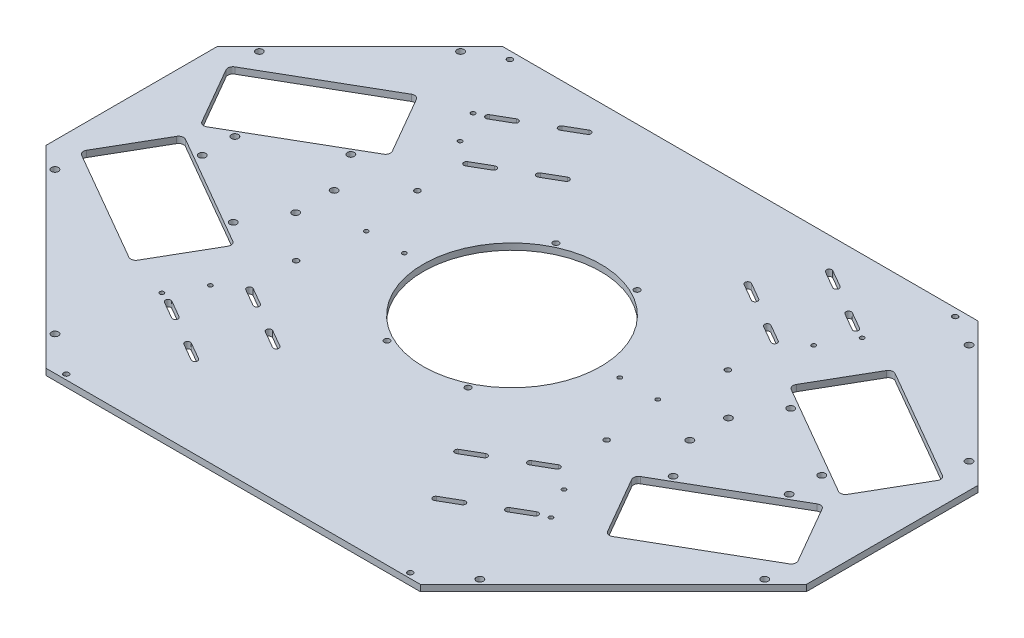
from build123d import *

# Parameters (mm, degrees)
EXTRUDE_1_DEPTH        = 5
CUT_EXTRUDE_1_REACH    = 374.055
SKETCH_3_R             = 70
HOLE_WIZARD_M4_1_D     = 4.3
CUT_EXTRUDE_2_REACH    = 374.055
FILLET_1_R             = 4
HOLE_WIZARD_M4_3_DEPTH = 5
HOLE_WIZARD_M5_2_D     = 5.5
HOLE_WIZARD_M5_3_D     = 5.5
HOLE_WIZARD_M4_2_D     = 4.5
HOLE_WIZARD_M4_1_2_D   = 3.3
HOLE_WIZARD_M4_2_2_D   = 3.3
FILLET_1_OF_MIRROR_1_R = 4
MIRROR_2_OUTLINE_R     = 1.65
MIRROR_2_OUTLINE_R_2   = 2.75
MIRROR_2_DEPTH         = 5
HOLE_WIZARD_M5_1_D     = 4.2


# Read off the part's stored shape, not the designer's step: M4 间隙槽口3, 镜向2
with BuildPart() as part:
    # 草图1 → 凸台-拉伸1 (new body)
    with BuildSketch(Plane(origin=(0, 0, 0), x_dir=(1, 0, 0), z_dir=(0, 1, 0))):
        Polygon((-300, 67.695526217), (-300, -67.695526217), (-147.695526217, -220), (147.695526217, -220), (300, -67.695526217), (300, 67.695526217), (187.695526217, 180), (-187.695526217, 180), align=None)
    extrude(amount=EXTRUDE_1_DEPTH)

    # 草图3 → 切除-拉伸1 (cut, up to next)
    with BuildSketch(Plane(origin=(0, 5, 0), x_dir=(1, 0, 0), z_dir=(0, 1, 0)), mode=Mode.PRIVATE) as cut_extrude_1_sk1:
        with Locations(Location((0, 0, 0), (0, 0, 270))):
            Circle(SKETCH_3_R)
    cut_extrude_1_tool1 = extrude(cut_extrude_1_sk1.sketch, amount=-CUT_EXTRUDE_1_REACH, mode=Mode.PRIVATE) & part.part
    add(cut_extrude_1_tool1.solids().sort_by_distance((0, 5, 0))[0], mode=Mode.SUBTRACT)

    # Hole Wizard M4 _1 (through all)
    with Locations(Plane(origin=(0, 5, 0), x_dir=(1, 0, 0), z_dir=(0, 1, 0))):
        with Locations((122.5, 47.85), (-122.5, -47.85), (-122.5, 47.85), (122.5, -47.85)):
            Hole(HOLE_WIZARD_M4_1_D / 2)

    # 草图6 → 切除-拉伸2 (cut, up to next)
    with BuildSketch(Plane(origin=(0, 5, 0), x_dir=(1, 0, 0), z_dir=(0, 1, 0)), mode=Mode.PRIVATE) as cut_extrude_2_sk1:
        Polygon((157.368602792, -61.469237886), (252.631397208, -6.469237886), (282.631397208, -58.430762114), (187.368602792, -113.430762114), align=None)
    cut_extrude_2_tool1 = extrude(cut_extrude_2_sk1.sketch, amount=-CUT_EXTRUDE_2_REACH, mode=Mode.PRIVATE) & part.part
    cut_extrude_2 = cut_extrude_2_tool1.solids().sort_by_distance((220, 5, 59.95))[0]
    add(cut_extrude_2, mode=Mode.SUBTRACT)

    # 圆角1
    fillet_1_edges = [part.edges().sort_by_distance(p)[0] for p in [
        (187.368602792, 2.5, 113.430762114),
        (157.368602792, 2.5, 61.469237886),
        (252.631397208, 2.5, 6.469237886),
        (282.631397208, 2.5, 58.430762114),
    ]]
    fillet(fillet_1_edges, radius=FILLET_1_R)

    # M4 间隙槽口3 outline → M4 间隙槽口3 (cut)
    with BuildSketch(Plane(origin=(0, 0, 0), x_dir=(1, 0, 0), z_dir=(0, 1, 0))):
        with BuildLine():
            Line((108.978007779, -95.354268716), (122.574606619, -87.504268716))
            ThreePointArc((122.574606619, -87.504268716), (123.361561237, -84.567314098), (120.424606619, -83.78035948))
            Line((120.424606619, -83.78035948), (106.828007779, -91.63035948))
            ThreePointArc((106.828007779, -91.63035948), (106.041053161, -94.567314098), (108.978007779, -95.354268716))
        make_face()
        with BuildLine():
            ThreePointArc((86.20153966, -108.504268716), (86.988494278, -105.567314098), (84.05153966, -104.78035948))
            Line((84.05153966, -104.78035948), (70.45494082, -112.63035948))
            ThreePointArc((70.45494082, -112.63035948), (69.667986202, -115.567314098), (72.60494082, -116.354268716))
            Line((72.60494082, -116.354268716), (86.20153966, -108.504268716))
        make_face()
        with BuildLine():
            Line((132.478007779, -136.057462694), (146.074606619, -128.207462694))
            ThreePointArc((146.074606619, -128.207462694), (146.861561237, -125.270508076), (143.924606619, -124.483553458))
            Line((143.924606619, -124.483553458), (130.328007779, -132.333553458))
            ThreePointArc((130.328007779, -132.333553458), (129.541053161, -135.270508076), (132.478007779, -136.057462694))
        make_face()
        with BuildLine():
            ThreePointArc((109.70153966, -149.207462694), (110.488494278, -146.270508076), (107.55153966, -145.483553458))
            Line((107.55153966, -145.483553458), (93.95494082, -153.333553458))
            ThreePointArc((93.95494082, -153.333553458), (93.167986202, -156.270508076), (96.10494082, -157.057462694))
            Line((96.10494082, -157.057462694), (109.70153966, -149.207462694))
        make_face()
    hole_wizard_m4_3 = extrude(amount=HOLE_WIZARD_M4_3_DEPTH, mode=Mode.SUBTRACT)

    # M5 间隙孔2 (through all)
    with Locations(Plane(origin=(0, 5, 0), x_dir=(1, 0, 0), z_dir=(0, 1, 0))):
        with Locations((-200.624458405, 160), (-280, 80.624458405), (-167.624458405, -193), (-280, -80.624458405), (280, 80.624458405), (200.624458405, 160), (280, -80.624458405), (167.624458405, -193)):
            Hole(HOLE_WIZARD_M5_2_D / 2)

    # M5 间隙孔3 (through all)
    with Locations(Plane(origin=(0, 0, 0), x_dir=(-1, 0, 0), z_dir=(0, -1, 0))):
        with Locations((155.528595468, 15.201901859), (231.552297521, 12.878816395), (173.528595468, 46.378816395)):
            hole_wizard_m5_3 = Hole(HOLE_WIZARD_M5_3_D / 2)

    # Hole Wizard M4 _2 (through all)
    with Locations(Plane(origin=(0, 0, 0), x_dir=(-1, 0, 0), z_dir=(0, -1, 0))):
        with Locations((-32, -66.689982551), (32, -66.689982551)):
            hole_wizard_m4_2 = Hole(HOLE_WIZARD_M4_2_D / 2)

    # Hole Wizard M4 _1 2 (through all)
    with Locations(Plane(origin=(0, 5, 0), x_dir=(1, 0, 0), z_dir=(0, 1, 0))):
        with Locations((153.498739063, -122.76643729), (139.498739063, -98.517725984)):
            hole_wizard_m4_1_2 = Hole(HOLE_WIZARD_M4_1_2_D / 2)

    # Hole Wizard M4 _2 2 (through all)
    with Locations(Plane(origin=(0, 5, 0), x_dir=(1, 0, 0), z_dir=(0, 1, 0))):
        with Locations((85, 0), (115, 0)):
            Hole(HOLE_WIZARD_M4_2_2_D / 2)

    # 镜向1: 切除-拉伸2, M4 间隙槽口3, M5 间隙孔3, Hole Wizard M4 _2, Hole Wizard M4 _1 2 across plane
    add(cut_extrude_2.mirror(Plane.XY), mode=Mode.SUBTRACT)
    add(hole_wizard_m4_3.mirror(Plane.XY), mode=Mode.SUBTRACT)
    add(hole_wizard_m5_3.mirror(Plane.XY), mode=Mode.SUBTRACT)
    add(hole_wizard_m4_2.mirror(Plane.XY), mode=Mode.SUBTRACT)
    add(hole_wizard_m4_1_2.mirror(Plane.XY), mode=Mode.SUBTRACT)

    # 圆角1 of 镜向1
    fillet_1_of_mirror_1_edges = [part.edges().sort_by_distance(p)[0] for p in [
        (187.368602792, 2.5, -113.430762114),
        (157.368602792, 2.5, -61.469237886),
        (252.631397208, 2.5, -6.469237886),
        (282.631397208, 2.5, -58.430762114),
    ]]
    fillet(fillet_1_of_mirror_1_edges, radius=FILLET_1_OF_MIRROR_1_R)

    # 镜向2 outline → 镜向2 (cut)
    with BuildSketch(Plane(origin=(0, 0, 0), x_dir=(1, 0, 0), z_dir=(0, 1, 0))):
        with BuildLine():
            Line((-185.368602792, -109.966660498), (-159.368602792, -64.933339502))
            ThreePointArc((-159.368602792, -64.933339502), (-158.969001102, -61.898063321), (-160.832704407, -59.469237886))
            Line((-160.832704407, -59.469237886), (-249.167295593, -8.469237886))
            ThreePointArc((-249.167295593, -8.469237886), (-252.202571774, -8.069636196), (-254.631397208, -9.933339502))
            Line((-254.631397208, -9.933339502), (-280.631397208, -54.966660498))
            ThreePointArc((-280.631397208, -54.966660498), (-281.030998898, -58.001936679), (-279.167295593, -60.430762114))
            Line((-279.167295593, -60.430762114), (-190.832704407, -111.430762114))
            ThreePointArc((-190.832704407, -111.430762114), (-187.797428226, -111.830363804), (-185.368602792, -109.966660498))
        make_face()
        with Locations((-115, 0)):
            Circle(MIRROR_2_OUTLINE_R)
        with Locations((-85, 0)):
            Circle(MIRROR_2_OUTLINE_R)
        with BuildLine():
            ThreePointArc((-160.832704407, 59.469237886), (-158.969001102, 61.898063321), (-159.368602792, 64.933339502))
            Line((-159.368602792, 64.933339502), (-185.368602792, 109.966660498))
            ThreePointArc((-185.368602792, 109.966660498), (-187.797428226, 111.830363804), (-190.832704407, 111.430762114))
            Line((-190.832704407, 111.430762114), (-279.167295593, 60.430762114))
            ThreePointArc((-279.167295593, 60.430762114), (-281.030998898, 58.001936679), (-280.631397208, 54.966660498))
            Line((-280.631397208, 54.966660498), (-254.631397208, 9.933339502))
            ThreePointArc((-254.631397208, 9.933339502), (-252.202571774, 8.069636196), (-249.167295593, 8.469237886))
            Line((-249.167295593, 8.469237886), (-160.832704407, 59.469237886))
        make_face()
        with BuildLine():
            Line((-108.978007779, 95.354268716), (-122.574606619, 87.504268716))
            ThreePointArc((-122.574606619, 87.504268716), (-123.361561237, 84.567314098), (-120.424606619, 83.78035948))
            Line((-120.424606619, 83.78035948), (-106.828007779, 91.63035948))
            ThreePointArc((-106.828007779, 91.63035948), (-106.041053161, 94.567314098), (-108.978007779, 95.354268716))
        make_face()
        with BuildLine():
            ThreePointArc((-86.20153966, 108.504268716), (-86.988494278, 105.567314098), (-84.05153966, 104.78035948))
            Line((-84.05153966, 104.78035948), (-70.45494082, 112.63035948))
            ThreePointArc((-70.45494082, 112.63035948), (-69.667986202, 115.567314098), (-72.60494082, 116.354268716))
            Line((-72.60494082, 116.354268716), (-86.20153966, 108.504268716))
        make_face()
        with BuildLine():
            Line((-132.478007779, 136.057462694), (-146.074606619, 128.207462694))
            ThreePointArc((-146.074606619, 128.207462694), (-146.861561237, 125.270508076), (-143.924606619, 124.483553458))
            Line((-143.924606619, 124.483553458), (-130.328007779, 132.333553458))
            ThreePointArc((-130.328007779, 132.333553458), (-129.541053161, 135.270508076), (-132.478007779, 136.057462694))
        make_face()
        with BuildLine():
            ThreePointArc((-109.70153966, 149.207462694), (-110.488494278, 146.270508076), (-107.55153966, 145.483553458))
            Line((-107.55153966, 145.483553458), (-93.95494082, 153.333553458))
            ThreePointArc((-93.95494082, 153.333553458), (-93.167986202, 156.270508076), (-96.10494082, 157.057462694))
            Line((-96.10494082, 157.057462694), (-109.70153966, 149.207462694))
        make_face()
        with Locations((173.528595468, -46.378816395)):
            Circle(MIRROR_2_OUTLINE_R_2)
        with Locations((231.552297521, -12.878816395)):
            Circle(MIRROR_2_OUTLINE_R_2)
        with Locations((155.528595468, -15.201901859)):
            Circle(MIRROR_2_OUTLINE_R_2)
        with Locations((-139.498739063, 98.517725984)):
            Circle(MIRROR_2_OUTLINE_R)
        with Locations((-153.498739063, 122.76643729)):
            Circle(MIRROR_2_OUTLINE_R)
        with BuildLine():
            Line((-106.828007779, -91.63035948), (-120.424606619, -83.78035948))
            ThreePointArc((-120.424606619, -83.78035948), (-123.361561237, -84.567314098), (-122.574606619, -87.504268716))
            Line((-122.574606619, -87.504268716), (-108.978007779, -95.354268716))
            ThreePointArc((-108.978007779, -95.354268716), (-106.041053161, -94.567314098), (-106.828007779, -91.63035948))
        make_face()
        with BuildLine():
            ThreePointArc((-84.05153966, -104.78035948), (-86.988494278, -105.567314098), (-86.20153966, -108.504268716))
            Line((-86.20153966, -108.504268716), (-72.60494082, -116.354268716))
            ThreePointArc((-72.60494082, -116.354268716), (-69.667986202, -115.567314098), (-70.45494082, -112.63035948))
            Line((-70.45494082, -112.63035948), (-84.05153966, -104.78035948))
        make_face()
        with BuildLine():
            Line((-130.328007779, -132.333553458), (-143.924606619, -124.483553458))
            ThreePointArc((-143.924606619, -124.483553458), (-146.861561237, -125.270508076), (-146.074606619, -128.207462694))
            Line((-146.074606619, -128.207462694), (-132.478007779, -136.057462694))
            ThreePointArc((-132.478007779, -136.057462694), (-129.541053161, -135.270508076), (-130.328007779, -132.333553458))
        make_face()
        with BuildLine():
            ThreePointArc((-107.55153966, -145.483553458), (-110.488494278, -146.270508076), (-109.70153966, -149.207462694))
            Line((-109.70153966, -149.207462694), (-96.10494082, -157.057462694))
            ThreePointArc((-96.10494082, -157.057462694), (-93.167986202, -156.270508076), (-93.95494082, -153.333553458))
            Line((-93.95494082, -153.333553458), (-107.55153966, -145.483553458))
        make_face()
        with Locations((173.528595468, 46.378816395)):
            Circle(MIRROR_2_OUTLINE_R_2)
        with Locations((231.552297521, 12.878816395)):
            Circle(MIRROR_2_OUTLINE_R_2)
        with Locations((155.528595468, 15.201901859)):
            Circle(MIRROR_2_OUTLINE_R_2)
        with Locations((-139.498739063, -98.517725984)):
            Circle(MIRROR_2_OUTLINE_R)
        with Locations((-153.498739063, -122.76643729)):
            Circle(MIRROR_2_OUTLINE_R)
    extrude(amount=MIRROR_2_DEPTH, mode=Mode.SUBTRACT)

    # Hole Wizard M5 _1 (through all)
    with Locations(Plane(origin=(0, 5, 0), x_dir=(1, 0, 0), z_dir=(0, 1, 0))):
        with Locations((-135.695526217, -216), (135.695526217, -216), (-175.695526217, 174), (175.695526217, 174)):
            Hole(HOLE_WIZARD_M5_1_D / 2)


solid = part.part
